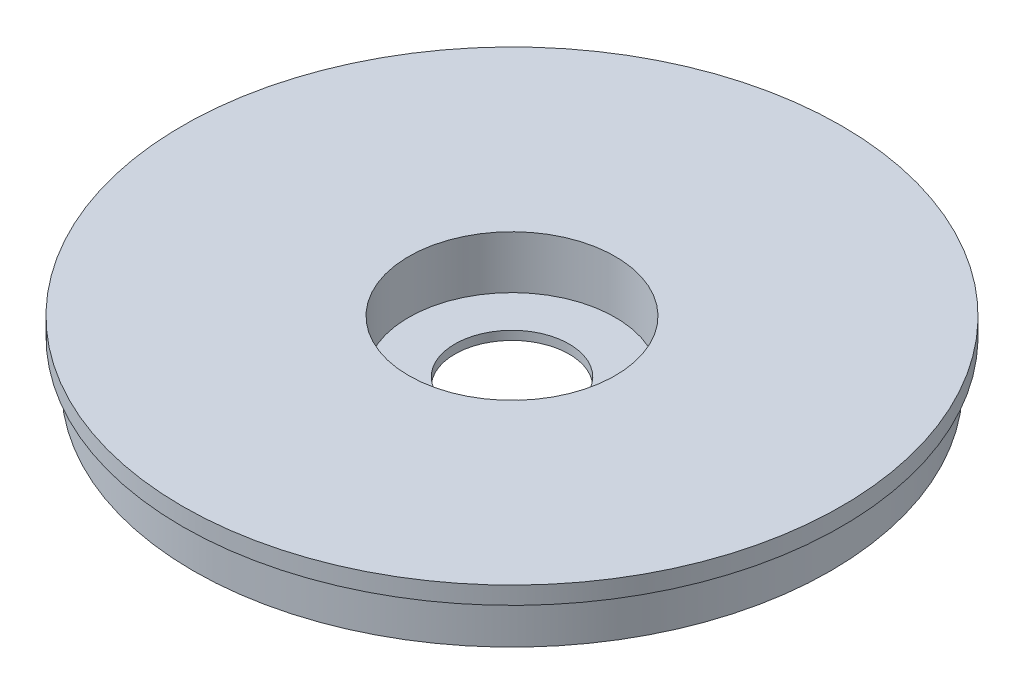
from build123d import *

# Parameters (mm, degrees)
SZKIC4_R                    = 75
DODANIE_WYCI_GNI_CIE2_DEPTH = 14
SZKIC5_R                    = 23.5
WYTNIJ_WYCI_GNI_CIE3_DEPTH  = 12
SZKIC6_R                    = 13
WYTNIJ_WYCI_GNI_CIE4_DEPTH  = 12
SZKIC7_R                    = 75
SZKIC7_R_2                  = 72.5
WYTNIJ_WYCI_GNI_CIE5_DEPTH  = 10


with BuildPart() as part:
    # Szkic4 → Dodanie-wyciągnięcie2 (new body)
    with BuildSketch(Plane(origin=(0, 0, 0), x_dir=(1, 0, 0), z_dir=(0, 1, 0))):
        Circle(SZKIC4_R)
    extrude(amount=DODANIE_WYCI_GNI_CIE2_DEPTH)

    # Szkic5 → Wytnij-wyciągnięcie3 (cut)
    with BuildSketch(Plane(origin=(0, 14, 0), x_dir=(1, 0, 0), z_dir=(0, 1, 0))):
        Circle(SZKIC5_R)
    extrude(amount=-WYTNIJ_WYCI_GNI_CIE3_DEPTH, mode=Mode.SUBTRACT)

    # Szkic6 → Wytnij-wyciągnięcie4 (cut)
    with BuildSketch(Plane(origin=(0, 2, 0), x_dir=(1, 0, 0), z_dir=(0, 1, 0))):
        Circle(SZKIC6_R)
    extrude(amount=-WYTNIJ_WYCI_GNI_CIE4_DEPTH, mode=Mode.SUBTRACT)

    # Szkic7 → Wytnij-wyciągnięcie5 (cut)
    with BuildSketch(Plane.XZ):
        Circle(SZKIC7_R)
        Circle(SZKIC7_R_2, mode=Mode.SUBTRACT)
    extrude(amount=-WYTNIJ_WYCI_GNI_CIE5_DEPTH, mode=Mode.SUBTRACT)


solid = part.part
